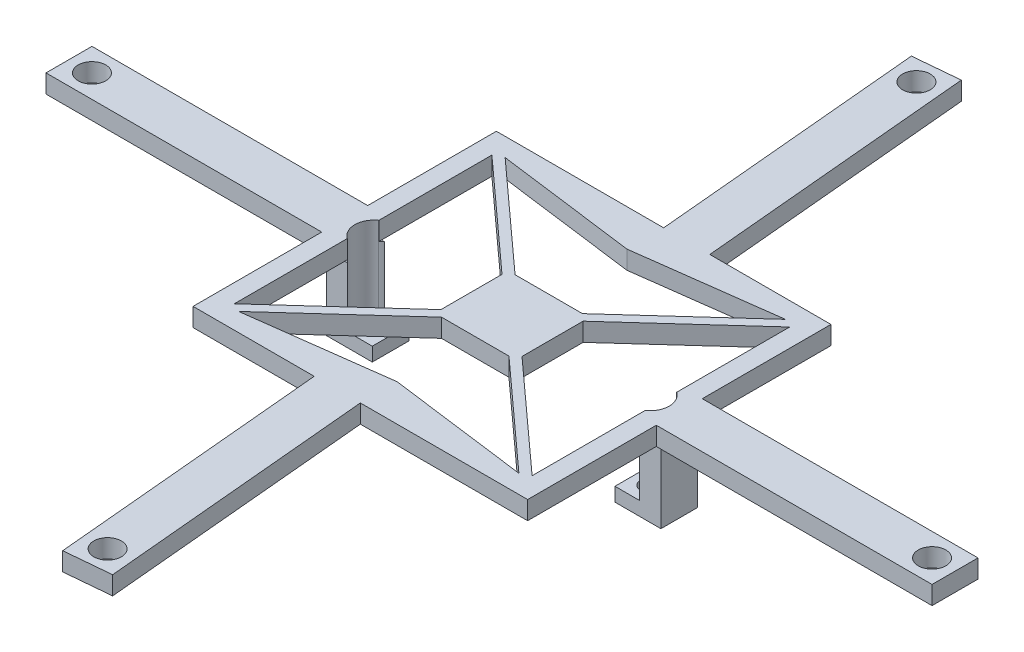
from build123d import *

# Parameters (mm, degrees)
SKETCH1_W           = 36.4
SKETCH1_H           = 33
BOSS_EXTRUDE1_DEPTH = 2
SKETCH2_W           = 5
SKETCH2_H           = 4
BOSS_EXTRUDE2_DEPTH = 8
SKETCH4_R           = 1
CUT_EXTRUDE2_DEPTH  = 27.162759793
CUT_EXTRUDE1_DEPTH  = 8.5
SKETCH5_W           = 5
SKETCH5_H           = 2
BOSS_EXTRUDE3_DEPTH = 30
SKETCH6_W           = 5
SKETCH6_H           = 2
BOSS_EXTRUDE4_DEPTH = 30
SKETCH11_R          = 1.5
CUT_EXTRUDE3_DEPTH  = 52.918108594
SKETCH10_R          = 1.5
BOSS_EXTRUDE5_DEPTH = 2


with BuildPart() as part:
    # Sketch1 → Boss-Extrude1 (new body)
    with BuildSketch(Plane(origin=(0, 0, 0), x_dir=(1, 0, 0), z_dir=(0, 1, 0))):
        Rectangle(SKETCH1_W, SKETCH1_H)
        Polygon((-4.412121212, -3.325108971), (-16.2, -14.011922158), (-16.2, 14.011922158), (-4.412121212, 3.325108971), align=None, mode=Mode.SUBTRACT)
        Polygon((-15.249514138, -14.5), (-3.667695956, -4), (3.667695956, -4), (15.249514138, -14.5), (0, -12.5), align=None, mode=Mode.SUBTRACT)
        Polygon((16.2, -14.011922158), (4.412121212, -3.325108971), (4.412121212, 3.325108971), (16.2, 14.011922158), align=None, mode=Mode.SUBTRACT)
        Polygon((15.249514138, 14.5), (3.667695956, 4), (-3.667695956, 4), (-15.249514138, 14.5), (0, 12.5), align=None, mode=Mode.SUBTRACT)
    extrude(amount=BOSS_EXTRUDE1_DEPTH)

    # Sketch2 → Boss-Extrude2 (add)
    with BuildSketch(Plane.XZ):
        with Locations((15.7, 0)):
            Rectangle(SKETCH2_W, SKETCH2_H)
        with Locations((-15.7, 0)):
            Rectangle(SKETCH2_W, SKETCH2_H)
    extrude(amount=BOSS_EXTRUDE2_DEPTH)

    # Sketch4 → Cut-Extrude2 (cut, through all)
    with BuildSketch(Plane(origin=(0, 1, 0), x_dir=(1, 0, 0), z_dir=(0, 1, 0))):
        with Locations((15, 0)):
            Circle(SKETCH4_R)
        with Locations((-15, 0)):
            Circle(SKETCH4_R)
    extrude(amount=-CUT_EXTRUDE2_DEPTH, mode=Mode.SUBTRACT)

    # Sketch3 → Cut-Extrude1 (cut)
    with BuildSketch(Plane(origin=(0, 2, 0), x_dir=(1, 0, 0), z_dir=(0, 1, 0))):
        with BuildLine():
            Line((15, 4.124318125), (15, 4.257967602))
            Line((15, 4.257967602), (10.3221916, 4.257967602))
            Line((10.3221916, 4.257967602), (10.3221916, -5.239749404))
            Line((10.3221916, -5.239749404), (15, -5.239749404))
            Line((15, -5.239749404), (15, -4.124318125))
            ThreePointArc((15, -4.124318125), (15.326601634, -2.763090306), (16.235294118, -1.69824864))
            ThreePointArc((16.235294118, -1.69824864), (17.1, 0), (16.235294118, 1.69824864))
            ThreePointArc((16.235294118, 1.69824864), (15.326601634, 2.763090306), (15, 4.124318125))
        make_face()
        with BuildLine():
            Line((-10.3221916, -5.239749404), (-15, -5.239749404))
            Line((-15, -5.239749404), (-15, -4.124318125))
            ThreePointArc((-15, -4.124318125), (-15.326601634, -2.763090306), (-16.235294118, -1.69824864))
            ThreePointArc((-16.235294118, -1.69824864), (-17.1, 0), (-16.235294118, 1.69824864))
            ThreePointArc((-16.235294118, 1.69824864), (-15.326601634, 2.763090306), (-15, 4.124318125))
            Line((-15, 4.124318125), (-15, 4.257967602))
            Line((-15, 4.257967602), (-10.3221916, 4.257967602))
            Line((-10.3221916, 4.257967602), (-10.3221916, -5.239749404))
        make_face()
    extrude(amount=-CUT_EXTRUDE1_DEPTH, mode=Mode.SUBTRACT)

    # Sketch5 → Boss-Extrude3 (add)
    with BuildSketch(Plane.ZY.offset(18.2)):
        with Locations((0, 1)):
            Rectangle(SKETCH5_W, SKETCH5_H)
    extrude(amount=BOSS_EXTRUDE3_DEPTH)

    # Sketch6 → Boss-Extrude4 (add)
    with BuildSketch(Plane(origin=(18.2, 0, 0), x_dir=(0, 0, -1), z_dir=(1, 0, 0))):
        with Locations((0, 1)):
            Rectangle(SKETCH6_W, SKETCH6_H)
    extrude(amount=BOSS_EXTRUDE4_DEPTH)

    # Sketch11 → Cut-Extrude3 (cut, through all)
    with BuildSketch(Plane(origin=(0, 2, 0), x_dir=(1, 0, 0), z_dir=(0, 1, 0))):
        with Locations((-45.7, 0)):
            Circle(SKETCH11_R)
        with Locations((45.7, 0)):
            Circle(SKETCH11_R)
    extrude(amount=-CUT_EXTRUDE3_DEPTH, mode=Mode.SUBTRACT)

    # Sketch10 → Boss-Extrude5 (add)
    # profile 1 of 2: a face of its own
    with BuildSketch(Plane(origin=(0, 2, 0), x_dir=(1, 0, 0), z_dir=(0, 1, 0))):
        Polygon((0, -16.5), (-5.02079011, -16.5), (-2.27177232, -46.613981094), (2.707523657, -46.15943564), align=None)
        with Locations((0, -44)):
            Circle(SKETCH10_R, mode=Mode.SUBTRACT)
    # profile 2 of 2: a face of its own
    with BuildSketch(Plane(origin=(0, 2, 0), x_dir=(1, 0, 0), z_dir=(0, 1, 0))):
        Polygon((0, 16.5), (5.02079011, 16.5), (2.27177232, 46.613981094), (-2.707523657, 46.15943564), align=None)
        with Locations((0, 44)):
            Circle(SKETCH10_R, mode=Mode.SUBTRACT)
    extrude(amount=-BOSS_EXTRUDE5_DEPTH)


solid = part.part
